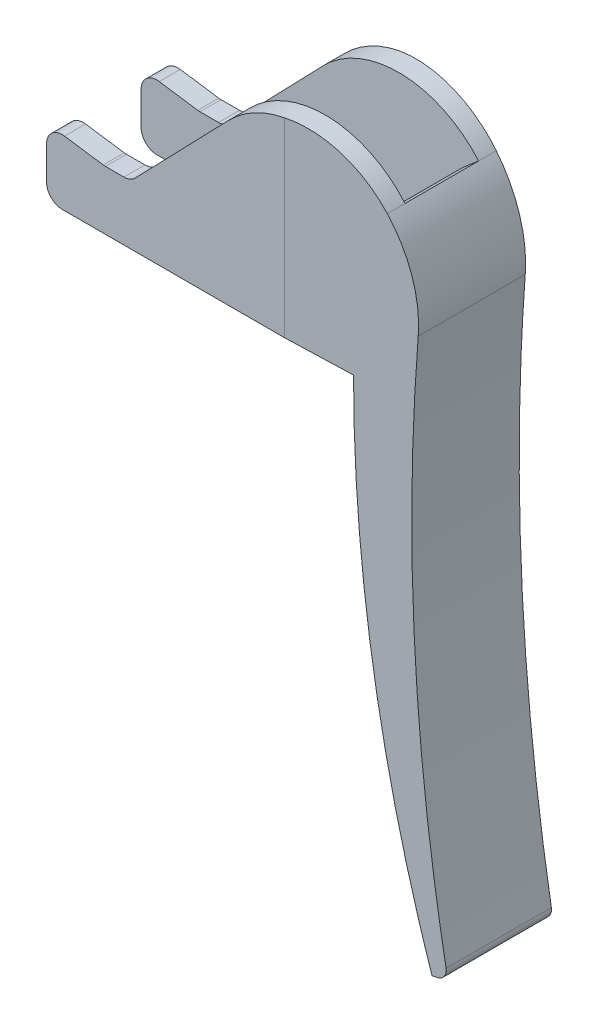
from build123d import *

# Parameters (mm, degrees)
BOSS_EXTRUDE1_DEPTH             = 5.5
BOSS_EXTRUDE1_DEPTH_BACK        = 5.5
SHELL4_START                    = -3.5
SHELL4_DEPTH                    = 7
CUT_EXTRUDE1_DEPTH              = 55.655740778
CUT_EXTRUDE1_DEPTH_BACK         = 55.655740778
SKETCH2_W                       = 69.221398806
SKETCH2_H                       = 30.475534722
BOSS_EXTRUDE2_REACH             = 56.656
SKETCH3_R                       = 1.8
BOSS_EXTRUDE2_DIRECTION_2_REACH = 56.656
FILLET1_R                       = 1.5
FILLET2_R                       = 1


# Read off the part's stored shape, not the designer's step: Shell4
with BuildPart() as part:
    # Sketch1 → Boss-Extrude1 (new, two sides: drawn at the far end of the back side and taken through both)
    with BuildSketch(Plane.XY.offset(-BOSS_EXTRUDE1_DEPTH_BACK)):
        with BuildLine():
            Line((0, 0), (-29, 0))
            Line((-29, 0), (-29, 6.4))
            Line((-29, 6.4), (-23.5, 5.6))
            Line((-23.5, 5.6), (-21, 5.6))
            Line((-21, 5.6), (-11.679922193, 15.24784279))
            ThreePointArc((-11.679922193, 15.24784279), (-4.185109089, 18.295419669), (3.11160179, 14.8))
            ThreePointArc((3.11160179, 14.8), (5.40105274, 10.720543521), (5.956739646, 6.07567938))
            ThreePointArc((5.956739646, 6.07567938), (5.643205462, -19.921417521), (8.704665249, -45.739527733))
            Line((8.704665249, -45.739527733), (7.227453619, -46))
            ThreePointArc((7.227453619, -46), (1.817879019, -23.282161013), (0, 0))
        make_face()
    extrude(amount=BOSS_EXTRUDE1_DEPTH + BOSS_EXTRUDE1_DEPTH_BACK)

    # Shell4 outline → Shell4 (cut)
    with BuildSketch(Plane.XY.offset(SHELL4_START)):
        with BuildLine():
            Line((1.591733374, 13.5), (3.11160179, 14.8))
            ThreePointArc((3.11160179, 14.8), (-4.185109088, 18.295419669), (-11.679922193, 15.24784279))
            Line((-11.679922193, 15.24784279), (-21, 5.6))
            Line((-21, 5.6), (-23.5, 5.6))
            Line((-23.5, 5.6), (-29, 6.4))
            Line((-29, 6.4), (-29, 0))
            Line((-29, 0), (0, 0))
            ThreePointArc((0, 0), (1.520272061, -21.301887027), (6.050271879, -42.171978539))
            ThreePointArc((6.050271879, -42.171978539), (3.550168012, -18.033934193), (3.962681588, 6.229732817))
            ThreePointArc((3.962681588, 6.229732817), (3.499609166, 10.100452934), (1.591733374, 13.5))
        make_face()
    extrude(amount=SHELL4_DEPTH, mode=Mode.SUBTRACT)

    # Sketch2 → Cut-Extrude1 (cut, two sides: drawn at the far end of the back side and taken through both)
    with BuildSketch(Plane(origin=(0, 0, 0), x_dir=(1, 0, 0), z_dir=(0, 1, 0)).offset(-CUT_EXTRUDE1_DEPTH_BACK)):
        Rectangle(SKETCH2_W, SKETCH2_H)
        Polygon((-29, 6.25), (8.704665249, 5), (8.704665249, -5), (-29, -6.25), align=None, mode=Mode.SUBTRACT)
    extrude(amount=CUT_EXTRUDE1_DEPTH + CUT_EXTRUDE1_DEPTH_BACK, mode=Mode.SUBTRACT)

    # Boss-Extrude2: up to this face of the body (flat: up to its plane)
    boss_extrude2_end = Plane(part.part.faces().sort_by_distance((-7.261638812, 3.224340324, 3.5))[0])
    # Sketch3 → Boss-Extrude2 (add, up to the picked face)
    with BuildSketch(Plane.XY, mode=Mode.PRIVATE) as boss_extrude2_sk1:
        with Locations(Location((-15.555262484, 4, 0), (0, 0, 180))):
            Circle(SKETCH3_R)
    boss_extrude2_tool1 = split(extrude(boss_extrude2_sk1.sketch, amount=BOSS_EXTRUDE2_REACH, mode=Mode.PRIVATE), bisect_by=boss_extrude2_end, keep=Keep.BOTH, mode=Mode.PRIVATE)
    add(boss_extrude2_tool1.solids().sort_by(Axis((-15.555262, 4, 0), (0, 0, 1)))[0])

    # Boss-Extrude2 direction 2: up to this face of the body (flat: up to its plane)
    boss_extrude2_direction_2_end = Plane(part.part.faces().sort_by_distance((-7.261638812, 3.224340324, -3.5))[0])
    # Sketch3 → Boss-Extrude2 direction 2 (add, up to the picked face)
    with BuildSketch(Plane.XY, mode=Mode.PRIVATE) as boss_extrude2_direction_2_sk1:
        with Locations(Location((-15.555262484, 4, 0), (0, 0, 180))):
            Circle(SKETCH3_R)
    boss_extrude2_direction_2_tool1 = split(extrude(boss_extrude2_direction_2_sk1.sketch, amount=-BOSS_EXTRUDE2_DIRECTION_2_REACH, mode=Mode.PRIVATE), bisect_by=boss_extrude2_direction_2_end, keep=Keep.BOTH, mode=Mode.PRIVATE)
    add(boss_extrude2_direction_2_tool1.solids().sort_by(Axis((-15.555262, 4, 0), (0, 0, -1)))[0])

    # Fillet1
    fillet1_edges = [part.edges().sort_by_distance(p)[0] for p in [
        (-29, 0, -4.5),
        (-29, 6.4, -4.5),
        (-23.5, 5.6, -4.5),
        (-21, 5.6, -4.5),
        (-21, 5.6, 4.5),
        (-23.5, 5.6, 4.5),
        (-29, 6.4, 4.5),
        (-29, 0, 4.5),
    ]]
    fillet(fillet1_edges, radius=FILLET1_R)

    # Fillet2
    fillet2_edges = [part.edges().sort_by_distance(p)[0] for p in [
        (8.704665249, -45.739527733, 0),
    ]]
    fillet(fillet2_edges, radius=FILLET2_R)


solid = part.part
